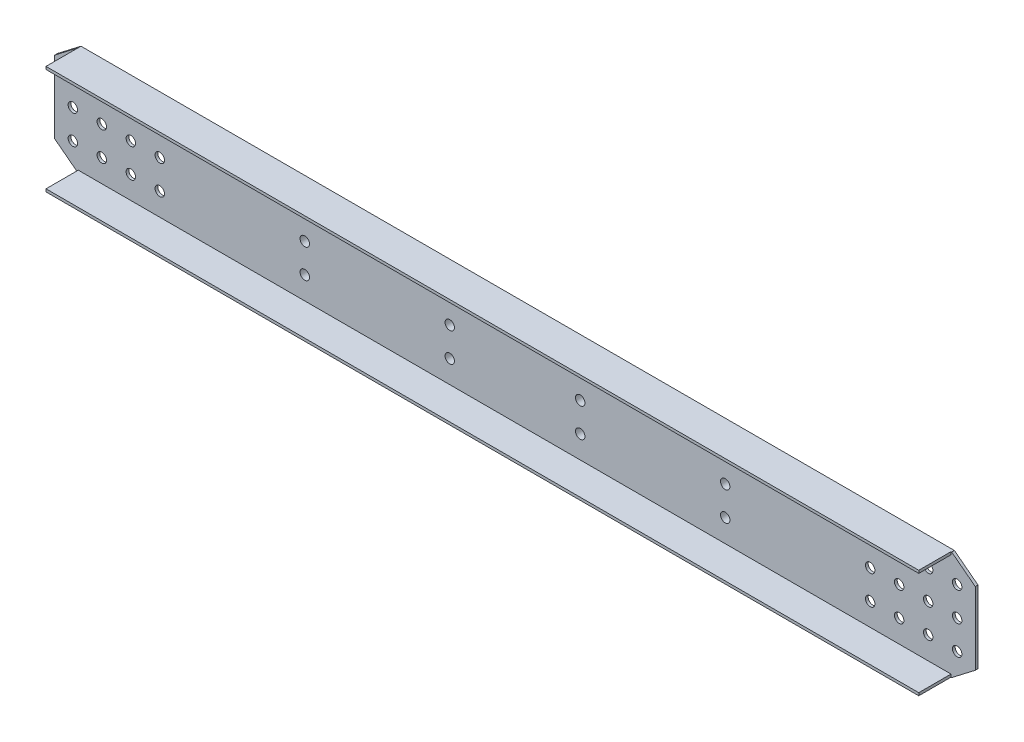
from build123d import *

# Parameters (mm, degrees)
SKETCH_1_R          = 13
EXTRUDE_729_DEPTH   = 7.5
SKETCH_2_W          = 2408.049034164
SKETCH_2_H          = 7.5
EXTRUDE_1_DEPTH     = 89
SKETCH_3_W          = 80
SKETCH_3_H          = 240
EXTRUDE_2_DEPTH     = 16
SKETCH_4_R          = 13
CUT_EXTRUDE_1_DEPTH = 1308.983562588


with BuildPart() as part:
    # 草图1 → Extrude 729 (new body)
    with BuildSketch(Plane.XY):
        Polygon((-1205, 0), (1205, 0), (1270, 50), (1270, 250), (1205, 300), (-1205, 300), (-1270, 250), (-1270, 50), align=None)
        with Locations((-1220, 230)):
            Circle(SKETCH_1_R, mode=Mode.SUBTRACT)
        with Locations((-1220, 150)):
            Circle(SKETCH_1_R, mode=Mode.SUBTRACT)
        with Locations((-1140, 230)):
            Circle(SKETCH_1_R, mode=Mode.SUBTRACT)
        with Locations((-1140, 150)):
            Circle(SKETCH_1_R, mode=Mode.SUBTRACT)
        with Locations((-1060, 230)):
            Circle(SKETCH_1_R, mode=Mode.SUBTRACT)
        with Locations((-1060, 150)):
            Circle(SKETCH_1_R, mode=Mode.SUBTRACT)
        with Locations((-980, 150)):
            Circle(SKETCH_1_R, mode=Mode.SUBTRACT)
        with Locations((-1060, 70)):
            Circle(SKETCH_1_R, mode=Mode.SUBTRACT)
        with Locations((-1140, 70)):
            Circle(SKETCH_1_R, mode=Mode.SUBTRACT)
        with Locations((-1220, 70)):
            Circle(SKETCH_1_R, mode=Mode.SUBTRACT)
        with Locations((1220, 70)):
            Circle(SKETCH_1_R, mode=Mode.SUBTRACT)
        with Locations((1140, 70)):
            Circle(SKETCH_1_R, mode=Mode.SUBTRACT)
        with Locations((1060, 70)):
            Circle(SKETCH_1_R, mode=Mode.SUBTRACT)
        with Locations((980, 150)):
            Circle(SKETCH_1_R, mode=Mode.SUBTRACT)
        with Locations((1060, 150)):
            Circle(SKETCH_1_R, mode=Mode.SUBTRACT)
        with Locations((1060, 230)):
            Circle(SKETCH_1_R, mode=Mode.SUBTRACT)
        with Locations((1140, 150)):
            Circle(SKETCH_1_R, mode=Mode.SUBTRACT)
        with Locations((1140, 230)):
            Circle(SKETCH_1_R, mode=Mode.SUBTRACT)
        with Locations((1220, 150)):
            Circle(SKETCH_1_R, mode=Mode.SUBTRACT)
        with Locations((1220, 230)):
            Circle(SKETCH_1_R, mode=Mode.SUBTRACT)
        with Locations((-980, 70)):
            Circle(SKETCH_1_R, mode=Mode.SUBTRACT)
        with Locations((-980, 230)):
            Circle(SKETCH_1_R, mode=Mode.SUBTRACT)
        with Locations((980, 70)):
            Circle(SKETCH_1_R, mode=Mode.SUBTRACT)
        with Locations((980, 230)):
            Circle(SKETCH_1_R, mode=Mode.SUBTRACT)
    extrude(amount=-EXTRUDE_729_DEPTH)

    # 草图2 → 凸台-拉伸1 (add)
    with BuildSketch(Plane.XY):
        with Locations((-0.975482918, 296.25)):
            Rectangle(SKETCH_2_W, SKETCH_2_H)
        with Locations((-0.975482918, 3.75)):
            Rectangle(SKETCH_2_W, SKETCH_2_H)
    extrude(amount=EXTRUDE_1_DEPTH)

    # 草图3 → 凸台-拉伸2 (add)
    with BuildSketch(Plane(origin=(0, 0, -7.5), x_dir=(-1, 0, 0), z_dir=(0, 0, -1))):
        with Locations((-580, 150)):
            Rectangle(SKETCH_3_W, SKETCH_3_H)
        with Locations((-180, 150)):
            Rectangle(SKETCH_3_W, SKETCH_3_H)
        with Locations((180, 150)):
            Rectangle(SKETCH_3_W, SKETCH_3_H)
        with Locations((580, 150)):
            Rectangle(SKETCH_3_W, SKETCH_3_H)
    extrude(amount=EXTRUDE_2_DEPTH)

    # 草图4 → 切除-拉伸1 (cut, through all)
    with BuildSketch(Plane.XY):
        with Locations((-580, 230)):
            Circle(SKETCH_4_R)
        with Locations((-580, 150)):
            Circle(SKETCH_4_R)
        with Locations((-180, 230)):
            Circle(SKETCH_4_R)
        with Locations((-180, 150)):
            Circle(SKETCH_4_R)
        with Locations((-180, 70)):
            Circle(SKETCH_4_R)
        with Locations((-580, 70)):
            Circle(SKETCH_4_R)
        with Locations((580, 70)):
            Circle(SKETCH_4_R)
        with Locations((180, 70)):
            Circle(SKETCH_4_R)
        with Locations((180, 150)):
            Circle(SKETCH_4_R)
        with Locations((180, 230)):
            Circle(SKETCH_4_R)
        with Locations((580, 150)):
            Circle(SKETCH_4_R)
        with Locations((580, 230)):
            Circle(SKETCH_4_R)
    extrude(amount=-CUT_EXTRUDE_1_DEPTH, mode=Mode.SUBTRACT)


solid = part.part
